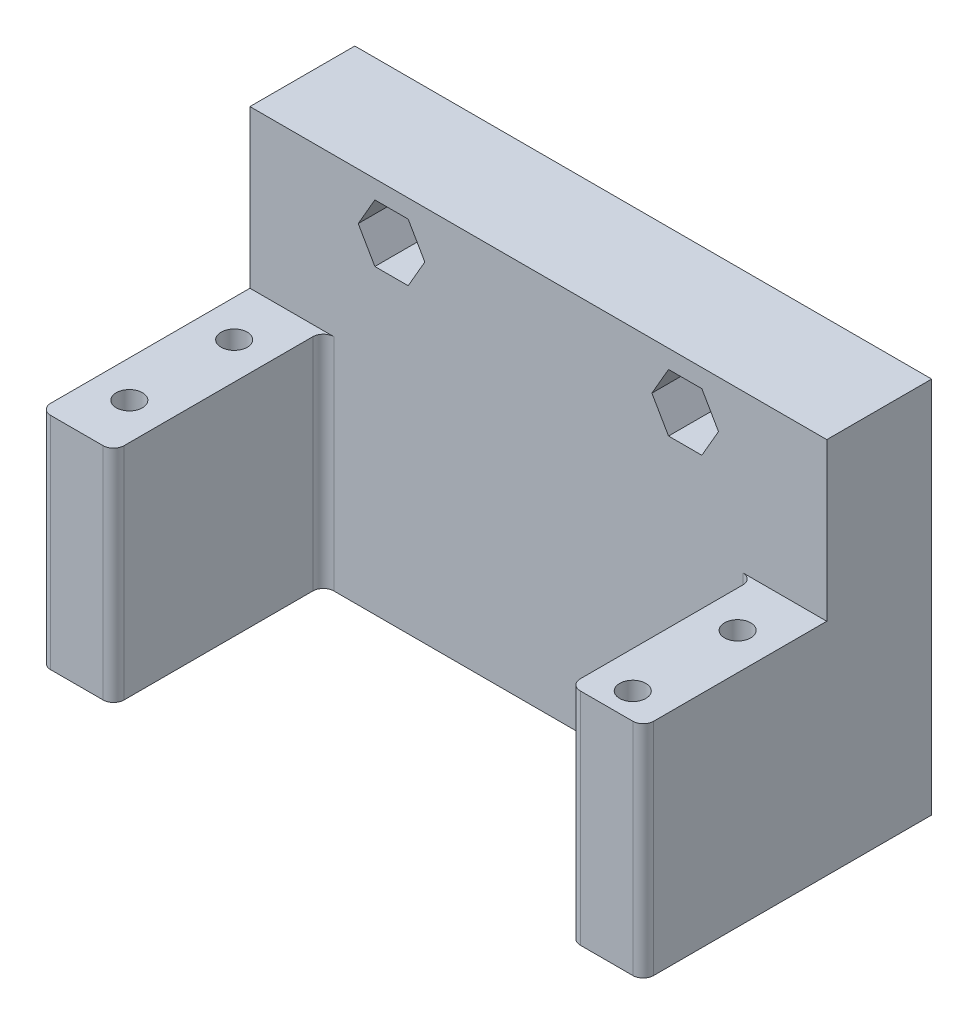
from build123d import *

# Parameters (mm, degrees)
SKETCH1_W           = 55
SKETCH1_H           = 36
SKETCH1_R           = 2
BOSS_EXTRUDE1_DEPTH = 10
SKETCH2_W           = 7
SKETCH2_H           = 20
SKETCH2_H_2         = 17.5
BOSS_EXTRUDE2_DEPTH = 21
SKETCH3_R           = 1.25
CUT_EXTRUDE1_DEPTH  = 10
CUT_EXTRUDE2_DEPTH  = 5.5
LPATTERN1_COUNT     = 2
LPATTERN1_PITCH     = 28
FILLET1_R           = 1


with BuildPart() as part:
    # Sketch1 → Boss-Extrude1 (new body)
    with BuildSketch(Plane.XY):
        with Locations((27.5, -18)):
            Rectangle(SKETCH1_W, SKETCH1_H)
        with Locations((13.5, -4.5)):
            Circle(SKETCH1_R, mode=Mode.SUBTRACT)
        with Locations((41.5, -4.5)):
            Circle(SKETCH1_R, mode=Mode.SUBTRACT)
    extrude(amount=BOSS_EXTRUDE1_DEPTH)

    # Sketch2 → Boss-Extrude2 (add)
    with BuildSketch(Plane.XZ.offset(36)):
        with Locations((3.5, 20)):
            Rectangle(SKETCH2_W, SKETCH2_H)
        with Locations((51.5, 18.75)):
            Rectangle(SKETCH2_W, SKETCH2_H_2)
    extrude(amount=-BOSS_EXTRUDE2_DEPTH)

    # Sketch3 → Cut-Extrude1 (cut)
    with BuildSketch(Plane(origin=(0, -15, 0), x_dir=(1, 0, 0), z_dir=(0, 1, 0))):
        with Locations((3.5, -15)):
            Circle(SKETCH3_R)
        with Locations((51.5, -15)):
            Circle(SKETCH3_R)
        with Locations((51.5, -25)):
            Circle(SKETCH3_R)
        with Locations((3.5, -25)):
            Circle(SKETCH3_R)
    extrude(amount=-CUT_EXTRUDE1_DEPTH, mode=Mode.SUBTRACT)

    # Sketch4 → Cut-Extrude2 (cut)
    with BuildSketch(Plane.XY.offset(10)):
        Polygon((11.91228676, -1.75), (10.324573519, -4.5), (11.91228676, -7.25), (15.08771324, -7.25), (16.675426481, -4.5), (15.08771324, -1.75), align=None)
    cut_extrude2 = extrude(amount=-CUT_EXTRUDE2_DEPTH, mode=Mode.SUBTRACT)

    # LPattern1: Cut-Extrude2 ×2
    with Locations(*[(i * LPATTERN1_PITCH, 0, 0) for i in range(1, LPATTERN1_COUNT)]):
        add(cut_extrude2, mode=Mode.SUBTRACT)

    # Fillet1
    fillet1_edges = [part.edges().sort_by_distance(p)[0] for p in [
        (48, -25.5, 27.5),
        (55, -25.5, 27.5),
        (7, -25.5, 30),
        (0, -25.5, 30),
        (48, -25.5, 10),
        (7, -25.5, 10),
    ]]
    fillet(fillet1_edges, radius=FILLET1_R)


solid = part.part
